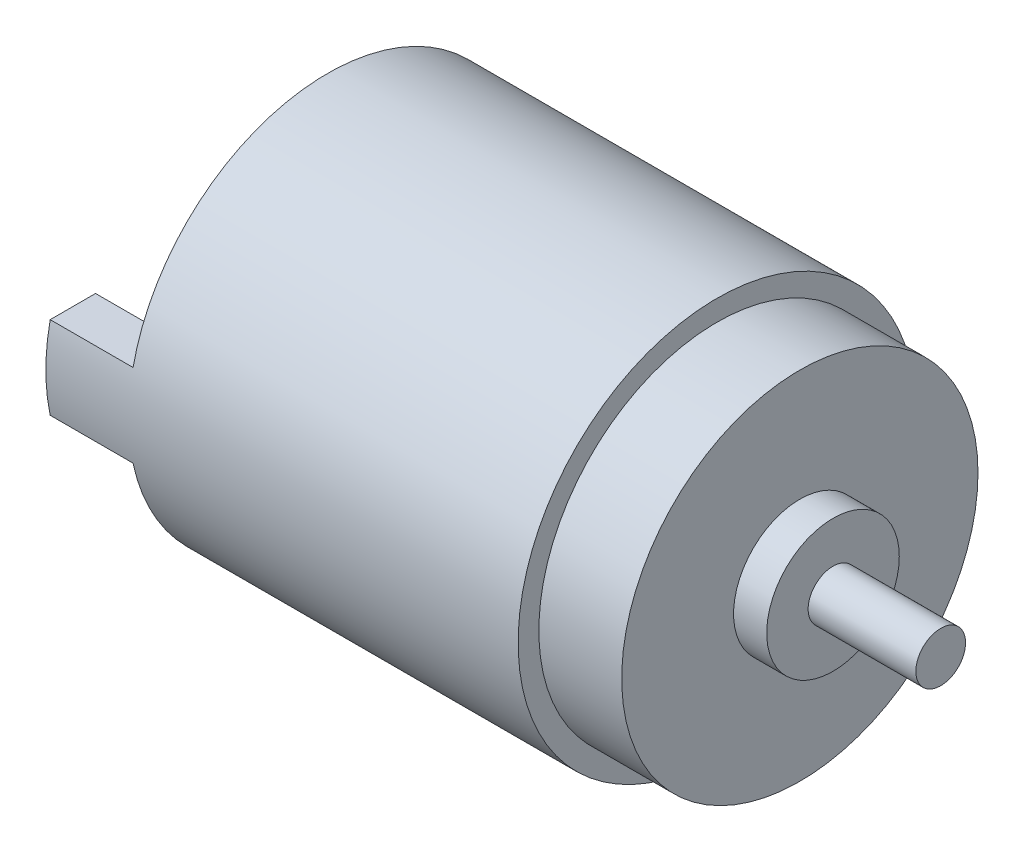
from build123d import *
from build123d.topology import SkipClean

# Parameters (mm, degrees)
SKETCH_1_R      = 12
EXTRUDE_1_DEPTH = 23.5
SKETCH_2_R      = 1.5
EXTRUDE_2_DEPTH = 13.5
SKETCH_3_R      = 10.75
EXTRUDE_3_DEPTH = 5
SKETCH_4_R      = 4
EXTRUDE_4_DEPTH = 2
EXTRUDE_5_DEPTH = 2
EXTRUDE_START   = 5
EXTRUDE_6_DEPTH = 5


with BuildPart() as part:
    # 草图1 → 凸台-拉伸1 (new body)
    with BuildSketch(Plane(origin=(0, 0, 0), x_dir=(0, 0, -1), z_dir=(1, 0, 0))):
        Circle(SKETCH_1_R)
    extrude(amount=EXTRUDE_1_DEPTH)

    # 草图2 → 凸台-拉伸2 (add)
    with BuildSketch(Plane(origin=(23.5, 0, 0), x_dir=(0, 0, -1), z_dir=(1, 0, 0))):
        Circle(SKETCH_2_R)
    extrude(amount=EXTRUDE_2_DEPTH)

    # 草图3 → 凸台-拉伸3 (add)
    with BuildSketch(Plane(origin=(23.5, 0, 0), x_dir=(0, 0, -1), z_dir=(1, 0, 0))):
        Circle(SKETCH_3_R)
    extrude(amount=EXTRUDE_3_DEPTH)

    # 草图4 → 凸台-拉伸4 (add)
    with BuildSketch(Plane(origin=(28.5, 0, 0), x_dir=(0, 0, -1), z_dir=(1, 0, 0))):
        Circle(SKETCH_4_R)
    extrude(amount=EXTRUDE_4_DEPTH)

    # 草图5 → 凸台-拉伸5 (add)
    with BuildSketch(Plane.ZY):
        with BuildLine():
            Line((-2.061552813, -4), (2.061552813, -4))
            ThreePointArc((2.061552813, -4), (0, 4.5), (-2.061552813, -4))
        make_face()
    extrude(amount=EXTRUDE_5_DEPTH)

    # 草图6 → 凸台-拉伸6 (add)
    with SkipClean():  # the faces are left unmerged after this step: merging them gives an invalid solid
        with BuildSketch(Plane.ZY.offset(EXTRUDE_START)):
            with BuildLine():
                Line((9, 2.5), (9, -2.5))
                Line((9, -2.5), (11.736694594, -2.5))
                ThreePointArc((11.736694594, -2.5), (12, 0), (11.736694594, 2.5))
                Line((11.736694594, 2.5), (9, 2.5))
            make_face()
        extrude_6 = extrude(amount=-EXTRUDE_6_DEPTH)

    # 镜向1: 凸台-拉伸6 across plane
    with SkipClean():  # the faces are left unmerged after this step: merging them gives an invalid solid
        add(extrude_6.mirror(Plane.XY))


solid = part.part
